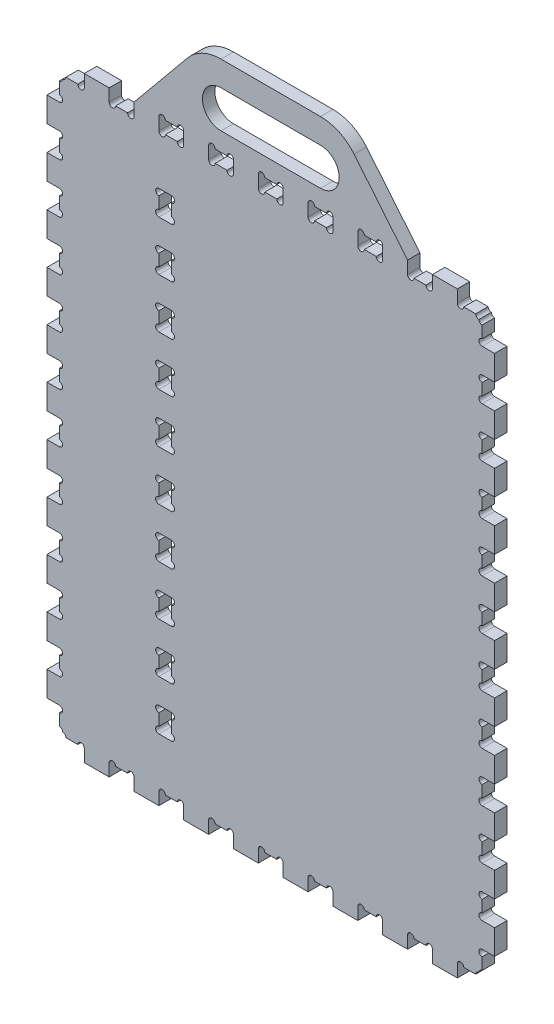
from build123d import *

# Parameters (mm, degrees)
SKETCH1_W               = 457.2
SKETCH1_H               = 609.6
BOSS_EXTRUDE1_DEPTH     = 12.7
CUT_EXTRUDE1_DEPTH      = 382.211607903
LPATTERN1_COUNT         = 9
LPATTERN1_PITCH         = 50.8
SKETCH6_W               = 12.7
SKETCH6_H               = 12.7
CUT_EXTRUDE4_DEPTH      = 382.211607903
CUT_EXTRUDE2_DEPTH      = 382.211607903
LPATTERN2_COUNT         = 12
LPATTERN2_PITCH         = 50.8
MIRROR7_COPY_1_SKETCH_W = 12.7
MIRROR7_COPY_1_SKETCH_H = 12.7
MIRROR7_COPY_1_DEPTH    = 382.211607903
MIRROR1_COPY_1_DEPTH    = 382.211607903
MIRROR1_COPY_2_DEPTH    = 382.211607903
MIRROR1_COPY_3_DEPTH    = 382.211607903
MIRROR1_COPY_4_DEPTH    = 382.211607903
MIRROR1_COPY_5_DEPTH    = 382.211607903
MIRROR1_COPY_6_DEPTH    = 382.211607903
MIRROR1_COPY_7_DEPTH    = 382.211607903
MIRROR1_COPY_8_DEPTH    = 382.211607903
MIRROR1_COPY_9_DEPTH    = 382.211607903
MIRROR1_COPY_10_DEPTH   = 382.211607903
MIRROR1_COPY_11_DEPTH   = 382.211607903
MIRROR1_COPY_12_DEPTH   = 382.211607903
MIRROR2_COPY_1_DEPTH    = 382.211607903
MIRROR2_COPY_2_DEPTH    = 382.211607903
MIRROR2_COPY_3_DEPTH    = 382.211607903
MIRROR2_COPY_4_DEPTH    = 382.211607903
MIRROR2_COPY_5_DEPTH    = 382.211607903
MIRROR2_COPY_6_DEPTH    = 382.211607903
MIRROR2_COPY_7_DEPTH    = 382.211607903
MIRROR2_COPY_8_DEPTH    = 382.211607903
MIRROR2_COPY_9_DEPTH    = 382.211607903
BOSS_EXTRUDE3_DEPTH     = 12.7
SKETCH10_R              = 3.302
CUT_EXTRUDE6_DEPTH      = 12.7
LPATTERN3_COUNT         = 5
LPATTERN3_PITCH         = 50.8
CUT_EXTRUDE7_DEPTH      = 450.954744947
LPATTERN4_COUNT         = 10
LPATTERN4_PITCH         = 50.8


with BuildPart() as part:
    # Sketch1 → Boss-Extrude1 (new body)
    with BuildSketch(Plane.XY):
        Rectangle(SKETCH1_W, SKETCH1_H)
    extrude(amount=BOSS_EXTRUDE1_DEPTH)

    # Sketch2 → Cut-Extrude1 (cut, through all)
    with BuildSketch(Plane.XY.offset(12.7)):
        with BuildLine():
            Line((-190.5, 304.8), (-215.9, 304.8))
            Line((-215.9, 304.8), (-215.9, 292.1))
            ThreePointArc((-215.9, 292.1), (-212.598, 288.798), (-209.296, 292.1))
            Line((-209.296, 292.1), (-197.104, 292.1))
            ThreePointArc((-197.104, 292.1), (-193.802, 288.798), (-190.5, 292.1))
            Line((-190.5, 292.1), (-190.5, 304.8))
        make_face()
    cut_extrude1 = extrude(amount=-CUT_EXTRUDE1_DEPTH, mode=Mode.SUBTRACT)

    # LPattern1: Cut-Extrude1 ×9
    with Locations(*[(i * LPATTERN1_PITCH, 0, 0) for i in range(1, LPATTERN1_COUNT)]):
        add(cut_extrude1, mode=Mode.SUBTRACT)

    # Sketch6 → Cut-Extrude4 (cut, through all)
    with BuildSketch(Plane.XY.offset(12.7)):
        with Locations((-222.25, 298.45)):
            Rectangle(SKETCH6_W, SKETCH6_H)
    cut_extrude4 = extrude(amount=-CUT_EXTRUDE4_DEPTH, mode=Mode.SUBTRACT)

    # Sketch3 → Cut-Extrude2 (cut, through all)
    with BuildSketch(Plane.XY.offset(12.7)):
        with BuildLine():
            Line((-215.9, 292.1), (-228.6, 292.1))
            Line((-228.6, 292.1), (-228.6, 266.7))
            Line((-228.6, 266.7), (-215.9, 266.7))
            ThreePointArc((-215.9, 266.7), (-212.598, 270.002), (-215.9, 273.304))
            Line((-215.9, 273.304), (-215.9, 285.496))
            ThreePointArc((-215.9, 285.496), (-212.598, 288.798), (-215.9, 292.1))
        make_face()
    cut_extrude2 = extrude(amount=-CUT_EXTRUDE2_DEPTH, mode=Mode.SUBTRACT)

    # LPattern2: Cut-Extrude2 ×12
    with Locations(*[(0, -i * LPATTERN2_PITCH, 0) for i in range(1, LPATTERN2_COUNT)]):
        add(cut_extrude2, mode=Mode.SUBTRACT)

    # Mirror6: Cut-Extrude4 across plane
    add(cut_extrude4.mirror(Plane(origin=(0, 0, 0), x_dir=(0, 0, 1), z_dir=(1, 0, 0))), mode=Mode.SUBTRACT)

    # Mirror7: Cut-Extrude4 across plane
    add(cut_extrude4.mirror(Plane.ZX), mode=Mode.SUBTRACT)

    # Mirror7 copy 1 sketch → Mirror7 copy 1 (cut, through all)
    with BuildSketch(Plane(origin=(0, 0, 12.7), x_dir=(-1, 0, 0), z_dir=(0, 0, 1))):
        with Locations((-222.25, 298.45)):
            Rectangle(MIRROR7_COPY_1_SKETCH_W, MIRROR7_COPY_1_SKETCH_H)
    extrude(amount=-MIRROR7_COPY_1_DEPTH, mode=Mode.SUBTRACT)

    # Mirror1 copy 1 sketch → Mirror1 copy 1 (cut, through all)
    with BuildSketch(Plane(origin=(0, -50.8, 12.7), x_dir=(-1, 0, 0), z_dir=(0, 0, 1))):
        with BuildLine():
            Line((-215.9, -292.1), (-228.6, -292.1))
            Line((-228.6, -292.1), (-228.6, -266.7))
            Line((-228.6, -266.7), (-215.9, -266.7))
            ThreePointArc((-215.9, -266.7), (-212.598, -270.002), (-215.9, -273.304))
            Line((-215.9, -273.304), (-215.9, -285.496))
            ThreePointArc((-215.9, -285.496), (-212.598, -288.798), (-215.9, -292.1))
        make_face()
    extrude(amount=-MIRROR1_COPY_1_DEPTH, mode=Mode.SUBTRACT)

    # Mirror1 copy 2 sketch → Mirror1 copy 2 (cut, through all)
    with BuildSketch(Plane(origin=(0, -101.6, 12.7), x_dir=(-1, 0, 0), z_dir=(0, 0, 1))):
        with BuildLine():
            Line((-215.9, -292.1), (-228.6, -292.1))
            Line((-228.6, -292.1), (-228.6, -266.7))
            Line((-228.6, -266.7), (-215.9, -266.7))
            ThreePointArc((-215.9, -266.7), (-212.598, -270.002), (-215.9, -273.304))
            Line((-215.9, -273.304), (-215.9, -285.496))
            ThreePointArc((-215.9, -285.496), (-212.598, -288.798), (-215.9, -292.1))
        make_face()
    extrude(amount=-MIRROR1_COPY_2_DEPTH, mode=Mode.SUBTRACT)

    # Mirror1 copy 3 sketch → Mirror1 copy 3 (cut, through all)
    with BuildSketch(Plane(origin=(0, -152.4, 12.7), x_dir=(-1, 0, 0), z_dir=(0, 0, 1))):
        with BuildLine():
            Line((-215.9, -292.1), (-228.6, -292.1))
            Line((-228.6, -292.1), (-228.6, -266.7))
            Line((-228.6, -266.7), (-215.9, -266.7))
            ThreePointArc((-215.9, -266.7), (-212.598, -270.002), (-215.9, -273.304))
            Line((-215.9, -273.304), (-215.9, -285.496))
            ThreePointArc((-215.9, -285.496), (-212.598, -288.798), (-215.9, -292.1))
        make_face()
    extrude(amount=-MIRROR1_COPY_3_DEPTH, mode=Mode.SUBTRACT)

    # Mirror1 copy 4 sketch → Mirror1 copy 4 (cut, through all)
    with BuildSketch(Plane(origin=(0, -203.2, 12.7), x_dir=(-1, 0, 0), z_dir=(0, 0, 1))):
        with BuildLine():
            Line((-215.9, -292.1), (-228.6, -292.1))
            Line((-228.6, -292.1), (-228.6, -266.7))
            Line((-228.6, -266.7), (-215.9, -266.7))
            ThreePointArc((-215.9, -266.7), (-212.598, -270.002), (-215.9, -273.304))
            Line((-215.9, -273.304), (-215.9, -285.496))
            ThreePointArc((-215.9, -285.496), (-212.598, -288.798), (-215.9, -292.1))
        make_face()
    extrude(amount=-MIRROR1_COPY_4_DEPTH, mode=Mode.SUBTRACT)

    # Mirror1 copy 5 sketch → Mirror1 copy 5 (cut, through all)
    with BuildSketch(Plane(origin=(0, -254, 12.7), x_dir=(-1, 0, 0), z_dir=(0, 0, 1))):
        with BuildLine():
            Line((-215.9, -292.1), (-228.6, -292.1))
            Line((-228.6, -292.1), (-228.6, -266.7))
            Line((-228.6, -266.7), (-215.9, -266.7))
            ThreePointArc((-215.9, -266.7), (-212.598, -270.002), (-215.9, -273.304))
            Line((-215.9, -273.304), (-215.9, -285.496))
            ThreePointArc((-215.9, -285.496), (-212.598, -288.798), (-215.9, -292.1))
        make_face()
    extrude(amount=-MIRROR1_COPY_5_DEPTH, mode=Mode.SUBTRACT)

    # Mirror1 copy 6 sketch → Mirror1 copy 6 (cut, through all)
    with BuildSketch(Plane(origin=(0, -304.8, 12.7), x_dir=(-1, 0, 0), z_dir=(0, 0, 1))):
        with BuildLine():
            Line((-215.9, -292.1), (-228.6, -292.1))
            Line((-228.6, -292.1), (-228.6, -266.7))
            Line((-228.6, -266.7), (-215.9, -266.7))
            ThreePointArc((-215.9, -266.7), (-212.598, -270.002), (-215.9, -273.304))
            Line((-215.9, -273.304), (-215.9, -285.496))
            ThreePointArc((-215.9, -285.496), (-212.598, -288.798), (-215.9, -292.1))
        make_face()
    extrude(amount=-MIRROR1_COPY_6_DEPTH, mode=Mode.SUBTRACT)

    # Mirror1 copy 7 sketch → Mirror1 copy 7 (cut, through all)
    with BuildSketch(Plane(origin=(0, -355.6, 12.7), x_dir=(-1, 0, 0), z_dir=(0, 0, 1))):
        with BuildLine():
            Line((-215.9, -292.1), (-228.6, -292.1))
            Line((-228.6, -292.1), (-228.6, -266.7))
            Line((-228.6, -266.7), (-215.9, -266.7))
            ThreePointArc((-215.9, -266.7), (-212.598, -270.002), (-215.9, -273.304))
            Line((-215.9, -273.304), (-215.9, -285.496))
            ThreePointArc((-215.9, -285.496), (-212.598, -288.798), (-215.9, -292.1))
        make_face()
    extrude(amount=-MIRROR1_COPY_7_DEPTH, mode=Mode.SUBTRACT)

    # Mirror1 copy 8 sketch → Mirror1 copy 8 (cut, through all)
    with BuildSketch(Plane(origin=(0, -406.4, 12.7), x_dir=(-1, 0, 0), z_dir=(0, 0, 1))):
        with BuildLine():
            Line((-215.9, -292.1), (-228.6, -292.1))
            Line((-228.6, -292.1), (-228.6, -266.7))
            Line((-228.6, -266.7), (-215.9, -266.7))
            ThreePointArc((-215.9, -266.7), (-212.598, -270.002), (-215.9, -273.304))
            Line((-215.9, -273.304), (-215.9, -285.496))
            ThreePointArc((-215.9, -285.496), (-212.598, -288.798), (-215.9, -292.1))
        make_face()
    extrude(amount=-MIRROR1_COPY_8_DEPTH, mode=Mode.SUBTRACT)

    # Mirror1 copy 9 sketch → Mirror1 copy 9 (cut, through all)
    with BuildSketch(Plane(origin=(0, -457.2, 12.7), x_dir=(-1, 0, 0), z_dir=(0, 0, 1))):
        with BuildLine():
            Line((-215.9, -292.1), (-228.6, -292.1))
            Line((-228.6, -292.1), (-228.6, -266.7))
            Line((-228.6, -266.7), (-215.9, -266.7))
            ThreePointArc((-215.9, -266.7), (-212.598, -270.002), (-215.9, -273.304))
            Line((-215.9, -273.304), (-215.9, -285.496))
            ThreePointArc((-215.9, -285.496), (-212.598, -288.798), (-215.9, -292.1))
        make_face()
    extrude(amount=-MIRROR1_COPY_9_DEPTH, mode=Mode.SUBTRACT)

    # Mirror1 copy 10 sketch → Mirror1 copy 10 (cut, through all)
    with BuildSketch(Plane(origin=(0, -508, 12.7), x_dir=(-1, 0, 0), z_dir=(0, 0, 1))):
        with BuildLine():
            Line((-215.9, -292.1), (-228.6, -292.1))
            Line((-228.6, -292.1), (-228.6, -266.7))
            Line((-228.6, -266.7), (-215.9, -266.7))
            ThreePointArc((-215.9, -266.7), (-212.598, -270.002), (-215.9, -273.304))
            Line((-215.9, -273.304), (-215.9, -285.496))
            ThreePointArc((-215.9, -285.496), (-212.598, -288.798), (-215.9, -292.1))
        make_face()
    extrude(amount=-MIRROR1_COPY_10_DEPTH, mode=Mode.SUBTRACT)

    # Mirror1 copy 11 sketch → Mirror1 copy 11 (cut, through all)
    with BuildSketch(Plane(origin=(0, -558.8, 12.7), x_dir=(-1, 0, 0), z_dir=(0, 0, 1))):
        with BuildLine():
            Line((-215.9, -292.1), (-228.6, -292.1))
            Line((-228.6, -292.1), (-228.6, -266.7))
            Line((-228.6, -266.7), (-215.9, -266.7))
            ThreePointArc((-215.9, -266.7), (-212.598, -270.002), (-215.9, -273.304))
            Line((-215.9, -273.304), (-215.9, -285.496))
            ThreePointArc((-215.9, -285.496), (-212.598, -288.798), (-215.9, -292.1))
        make_face()
    extrude(amount=-MIRROR1_COPY_11_DEPTH, mode=Mode.SUBTRACT)

    # Mirror1 copy 12 sketch → Mirror1 copy 12 (cut, through all)
    with BuildSketch(Plane(origin=(0, 0, 12.7), x_dir=(-1, 0, 0), z_dir=(0, 0, 1))):
        with BuildLine():
            Line((-215.9, -292.1), (-228.6, -292.1))
            Line((-228.6, -292.1), (-228.6, -266.7))
            Line((-228.6, -266.7), (-215.9, -266.7))
            ThreePointArc((-215.9, -266.7), (-212.598, -270.002), (-215.9, -273.304))
            Line((-215.9, -273.304), (-215.9, -285.496))
            ThreePointArc((-215.9, -285.496), (-212.598, -288.798), (-215.9, -292.1))
        make_face()
    extrude(amount=-MIRROR1_COPY_12_DEPTH, mode=Mode.SUBTRACT)

    # Mirror2 copy 1 sketch → Mirror2 copy 1 (cut, through all)
    with BuildSketch(Plane(origin=(50.8, 0, 12.7), x_dir=(1, 0, 0), z_dir=(0, 0, 1))):
        with BuildLine():
            Line((-190.5, -304.8), (-215.9, -304.8))
            Line((-215.9, -304.8), (-215.9, -292.1))
            ThreePointArc((-215.9, -292.1), (-212.598, -288.798), (-209.296, -292.1))
            Line((-209.296, -292.1), (-197.104, -292.1))
            ThreePointArc((-197.104, -292.1), (-193.802, -288.798), (-190.5, -292.1))
            Line((-190.5, -292.1), (-190.5, -304.8))
        make_face()
    extrude(amount=-MIRROR2_COPY_1_DEPTH, mode=Mode.SUBTRACT)

    # Mirror2 copy 2 sketch → Mirror2 copy 2 (cut, through all)
    with BuildSketch(Plane(origin=(101.6, 0, 12.7), x_dir=(1, 0, 0), z_dir=(0, 0, 1))):
        with BuildLine():
            Line((-190.5, -304.8), (-215.9, -304.8))
            Line((-215.9, -304.8), (-215.9, -292.1))
            ThreePointArc((-215.9, -292.1), (-212.598, -288.798), (-209.296, -292.1))
            Line((-209.296, -292.1), (-197.104, -292.1))
            ThreePointArc((-197.104, -292.1), (-193.802, -288.798), (-190.5, -292.1))
            Line((-190.5, -292.1), (-190.5, -304.8))
        make_face()
    extrude(amount=-MIRROR2_COPY_2_DEPTH, mode=Mode.SUBTRACT)

    # Mirror2 copy 3 sketch → Mirror2 copy 3 (cut, through all)
    with BuildSketch(Plane(origin=(152.4, 0, 12.7), x_dir=(1, 0, 0), z_dir=(0, 0, 1))):
        with BuildLine():
            Line((-190.5, -304.8), (-215.9, -304.8))
            Line((-215.9, -304.8), (-215.9, -292.1))
            ThreePointArc((-215.9, -292.1), (-212.598, -288.798), (-209.296, -292.1))
            Line((-209.296, -292.1), (-197.104, -292.1))
            ThreePointArc((-197.104, -292.1), (-193.802, -288.798), (-190.5, -292.1))
            Line((-190.5, -292.1), (-190.5, -304.8))
        make_face()
    extrude(amount=-MIRROR2_COPY_3_DEPTH, mode=Mode.SUBTRACT)

    # Mirror2 copy 4 sketch → Mirror2 copy 4 (cut, through all)
    with BuildSketch(Plane(origin=(203.2, 0, 12.7), x_dir=(1, 0, 0), z_dir=(0, 0, 1))):
        with BuildLine():
            Line((-190.5, -304.8), (-215.9, -304.8))
            Line((-215.9, -304.8), (-215.9, -292.1))
            ThreePointArc((-215.9, -292.1), (-212.598, -288.798), (-209.296, -292.1))
            Line((-209.296, -292.1), (-197.104, -292.1))
            ThreePointArc((-197.104, -292.1), (-193.802, -288.798), (-190.5, -292.1))
            Line((-190.5, -292.1), (-190.5, -304.8))
        make_face()
    extrude(amount=-MIRROR2_COPY_4_DEPTH, mode=Mode.SUBTRACT)

    # Mirror2 copy 5 sketch → Mirror2 copy 5 (cut, through all)
    with BuildSketch(Plane(origin=(254, 0, 12.7), x_dir=(1, 0, 0), z_dir=(0, 0, 1))):
        with BuildLine():
            Line((-190.5, -304.8), (-215.9, -304.8))
            Line((-215.9, -304.8), (-215.9, -292.1))
            ThreePointArc((-215.9, -292.1), (-212.598, -288.798), (-209.296, -292.1))
            Line((-209.296, -292.1), (-197.104, -292.1))
            ThreePointArc((-197.104, -292.1), (-193.802, -288.798), (-190.5, -292.1))
            Line((-190.5, -292.1), (-190.5, -304.8))
        make_face()
    extrude(amount=-MIRROR2_COPY_5_DEPTH, mode=Mode.SUBTRACT)

    # Mirror2 copy 6 sketch → Mirror2 copy 6 (cut, through all)
    with BuildSketch(Plane(origin=(304.8, 0, 12.7), x_dir=(1, 0, 0), z_dir=(0, 0, 1))):
        with BuildLine():
            Line((-190.5, -304.8), (-215.9, -304.8))
            Line((-215.9, -304.8), (-215.9, -292.1))
            ThreePointArc((-215.9, -292.1), (-212.598, -288.798), (-209.296, -292.1))
            Line((-209.296, -292.1), (-197.104, -292.1))
            ThreePointArc((-197.104, -292.1), (-193.802, -288.798), (-190.5, -292.1))
            Line((-190.5, -292.1), (-190.5, -304.8))
        make_face()
    extrude(amount=-MIRROR2_COPY_6_DEPTH, mode=Mode.SUBTRACT)

    # Mirror2 copy 7 sketch → Mirror2 copy 7 (cut, through all)
    with BuildSketch(Plane(origin=(355.6, 0, 12.7), x_dir=(1, 0, 0), z_dir=(0, 0, 1))):
        with BuildLine():
            Line((-190.5, -304.8), (-215.9, -304.8))
            Line((-215.9, -304.8), (-215.9, -292.1))
            ThreePointArc((-215.9, -292.1), (-212.598, -288.798), (-209.296, -292.1))
            Line((-209.296, -292.1), (-197.104, -292.1))
            ThreePointArc((-197.104, -292.1), (-193.802, -288.798), (-190.5, -292.1))
            Line((-190.5, -292.1), (-190.5, -304.8))
        make_face()
    extrude(amount=-MIRROR2_COPY_7_DEPTH, mode=Mode.SUBTRACT)

    # Mirror2 copy 8 sketch → Mirror2 copy 8 (cut, through all)
    with BuildSketch(Plane(origin=(406.4, 0, 12.7), x_dir=(1, 0, 0), z_dir=(0, 0, 1))):
        with BuildLine():
            Line((-190.5, -304.8), (-215.9, -304.8))
            Line((-215.9, -304.8), (-215.9, -292.1))
            ThreePointArc((-215.9, -292.1), (-212.598, -288.798), (-209.296, -292.1))
            Line((-209.296, -292.1), (-197.104, -292.1))
            ThreePointArc((-197.104, -292.1), (-193.802, -288.798), (-190.5, -292.1))
            Line((-190.5, -292.1), (-190.5, -304.8))
        make_face()
    extrude(amount=-MIRROR2_COPY_8_DEPTH, mode=Mode.SUBTRACT)

    # Mirror2 copy 9 sketch → Mirror2 copy 9 (cut, through all)
    with BuildSketch(Plane.XY.offset(12.7)):
        with BuildLine():
            Line((-190.5, -304.8), (-215.9, -304.8))
            Line((-215.9, -304.8), (-215.9, -292.1))
            ThreePointArc((-215.9, -292.1), (-212.598, -288.798), (-209.296, -292.1))
            Line((-209.296, -292.1), (-197.104, -292.1))
            ThreePointArc((-197.104, -292.1), (-193.802, -288.798), (-190.5, -292.1))
            Line((-190.5, -292.1), (-190.5, -304.8))
        make_face()
    extrude(amount=-MIRROR2_COPY_9_DEPTH, mode=Mode.SUBTRACT)

    # Sketch9 → Boss-Extrude3 (add)
    with BuildSketch(Plane.XY.offset(12.7)):
        with BuildLine():
            Line((-50.8, 387.35), (50.8, 387.35))
            ThreePointArc((50.8, 387.35), (69.781367551, 383.093409732), (85.127373824, 371.138872257))
            Line((85.127373824, 371.138872257), (139.7, 304.8))
            Line((139.7, 304.8), (-139.7, 304.8))
            Line((-139.7, 304.8), (-85.127373824, 371.138872257))
            ThreePointArc((-85.127373824, 371.138872257), (-69.781367551, 383.093409732), (-50.8, 387.35))
        make_face()
        with BuildLine():
            Line((-50.8, 361.95), (50.8, 361.95))
            ThreePointArc((50.8, 361.95), (69.85, 342.9), (50.8, 323.85))
            Line((50.8, 323.85), (-50.8, 323.85))
            ThreePointArc((-50.8, 323.85), (-69.85, 342.9), (-50.8, 361.95))
        make_face(mode=Mode.SUBTRACT)
    extrude(amount=-BOSS_EXTRUDE3_DEPTH)

    # Sketch10 → Cut-Extrude6 (cut)
    with BuildSketch(Plane.XY.offset(12.7)):
        with Locations((-110.998, 304.8)):
            Circle(SKETCH10_R)
        with Locations((-92.202, 304.8)):
            Circle(SKETCH10_R)
    cut_extrude6 = extrude(amount=-CUT_EXTRUDE6_DEPTH, mode=Mode.SUBTRACT)

    # LPattern3: Cut-Extrude6 ×5
    with Locations(*[(i * LPATTERN3_PITCH, 0, 0) for i in range(1, LPATTERN3_COUNT)]):
        add(cut_extrude6, mode=Mode.SUBTRACT)

    # Sketch11 → Cut-Extrude7 (cut, through all)
    with BuildSketch(Plane.XY.offset(12.7)):
        with BuildLine():
            Line((-101.6, 241.3), (-114.3, 241.3))
            ThreePointArc((-114.3, 241.3), (-117.602, 237.998), (-114.3, 234.696))
            Line((-114.3, 234.696), (-114.3, 222.504))
            ThreePointArc((-114.3, 222.504), (-117.602, 219.202), (-114.3, 215.9))
            Line((-114.3, 215.9), (-101.6, 215.9))
            ThreePointArc((-101.6, 215.9), (-98.298, 219.202), (-101.6, 222.504))
            Line((-101.6, 222.504), (-101.6, 234.696))
            ThreePointArc((-101.6, 234.696), (-98.298, 237.998), (-101.6, 241.3))
        make_face()
    cut_extrude7 = extrude(amount=-CUT_EXTRUDE7_DEPTH, mode=Mode.SUBTRACT)

    # LPattern4: Cut-Extrude7 ×10
    with Locations(*[(0, -i * LPATTERN4_PITCH, 0) for i in range(1, LPATTERN4_COUNT)]):
        add(cut_extrude7, mode=Mode.SUBTRACT)


solid = part.part
